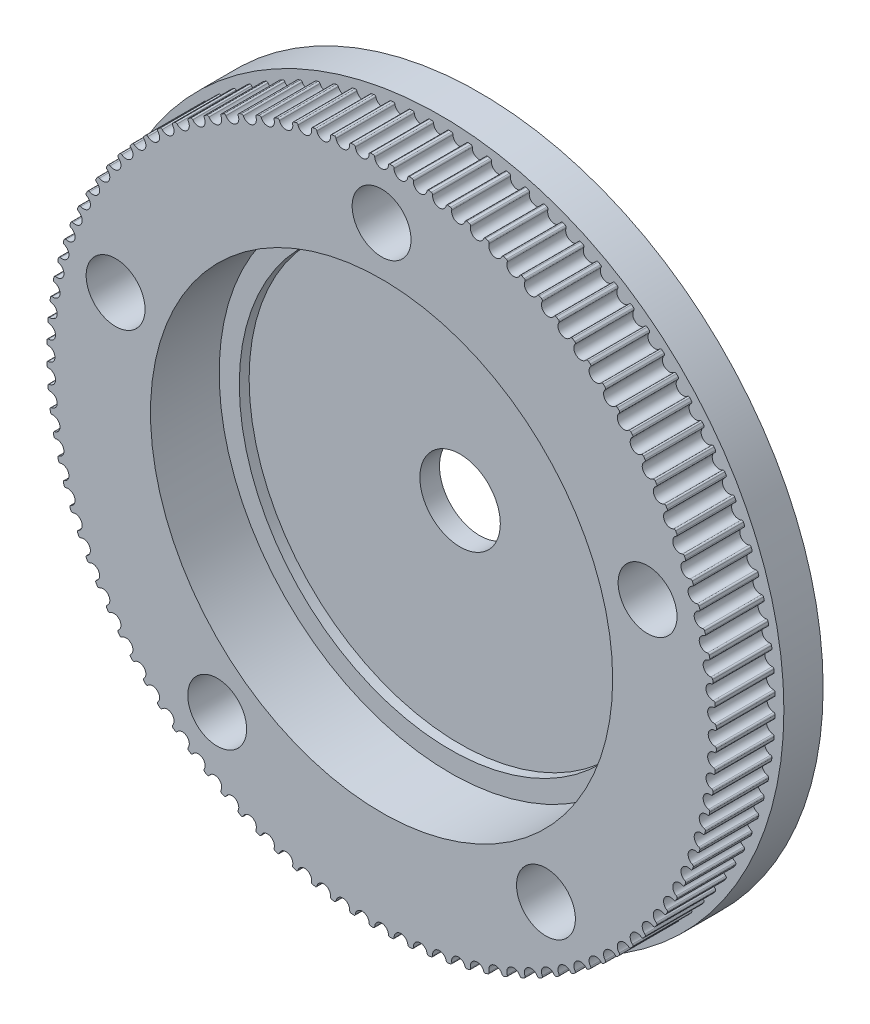
from build123d import *

# Parameters (mm, degrees)
SKETCH_1_R          = 35
SKETCH_1_R_2        = 4.1
EXTRUDE_1_DEPTH     = 4
SKETCH_2_R          = 4.1
EXTRUDE_2_DEPTH     = 6
SKETCH_4_R          = 23.55
CUT_EXTRUDE_2_DEPTH = 7
SKETCH_6_R          = 21.5
CUT_EXTRUDE_3_DEPTH = 1
SKETCH_7_R          = 1.75
CUT_EXTRUDE_4_DEPTH = 51.497524692
SKETCH_8_R          = 3
CUT_EXTRUDE_5_DEPTH = 8


with BuildPart() as part:
    # 草图1 → 凸台-拉伸1 (new body)
    with BuildSketch(Plane.XY):
        Circle(SKETCH_1_R)
        Circle(SKETCH_1_R_2, mode=Mode.SUBTRACT)
    extrude(amount=EXTRUDE_1_DEPTH)

    # 草图2 → 凸台-拉伸2 (add)
    with BuildSketch(Plane.XY.offset(4)):
        with BuildLine():
            ThreePointArc((1.121572838, 34.104062524), (0.992443315, 34.108064479), (0.863299566, 34.111577508))
            ThreePointArc((0.863299566, 34.111577508), (0.749968837, 34.068493113), (0.699390809, 33.95830245))
            ThreePointArc((0.699390809, 33.95830245), (0, 33.2875), (-0.699390809, 33.95830245))
            ThreePointArc((-0.699390809, 33.95830245), (-0.749968837, 34.068493113), (-0.863299566, 34.111577508))
            ThreePointArc((-0.863299566, 34.111577508), (-0.992443315, 34.108064479), (-1.121572838, 34.104062524))
            ThreePointArc((-1.121572838, 34.104062524), (-1.232206695, 34.054461424), (-1.276292136, 33.941516335))
            ThreePointArc((-1.276292136, 33.941516335), (-1.935495992, 33.231182818), (-2.672707236, 33.860184418))
            ThreePointArc((-2.672707236, 33.860184418), (-2.729606712, 33.967247805), (-2.845250838, 34.003669713))
            ThreePointArc((-2.845250838, 34.003669713), (-2.973971832, 33.992653586), (-3.102650195, 33.981150187))
            ThreePointArc((-3.102650195, 33.981150187), (-3.210212829, 33.925200218), (-3.247656512, 33.809882874))
            ThreePointArc((-3.247656512, 33.809882874), (-3.864442879, 33.062421833), (-4.636980068, 33.64749424))
            ThreePointArc((-4.636980068, 33.64749424), (-4.700008462, 33.751068082), (-4.817574682, 33.780704262))
            ThreePointArc((-4.817574682, 33.780704262), (-4.945437369, 33.762222312), (-5.073229166, 33.743256394))
            ThreePointArc((-5.073229166, 33.743256394), (-5.17735662, 33.681146873), (-5.208031846, 33.563847471))
            ThreePointArc((-5.208031846, 33.563847471), (-5.780313714, 32.781788078), (-6.585562828, 33.320951592))
            ThreePointArc((-6.585562828, 33.320951592), (-6.65450687, 33.420685429), (-6.773597378, 33.443435601))
            ThreePointArc((-6.773597378, 33.443435601), (-6.900169112, 33.417550366), (-7.026641935, 33.391186103))
            ThreePointArc((-7.026641935, 33.391186103), (-7.126981874, 33.323127188), (-7.15078485, 33.204242632))
            ThreePointArc((-7.15078485, 33.204242632), (-7.676625797, 32.390231129), (-8.511862127, 32.881661392))
            ThreePointArc((-8.511862127, 32.881661392), (-8.586488534, 32.977217756), (-8.706700364, 32.993004941))
            ThreePointArc((-8.706700364, 32.993004941), (-8.831552867, 32.959804008), (-8.956278772, 32.926130608))
            ThreePointArc((-8.956278772, 32.926130608), (-9.052491678, 32.85235259), (-9.06934186, 32.732285148))
            ThreePointArc((-9.06934186, 32.732285148), (-9.546962609, 31.889075891), (-10.40935998, 32.331110058))
            ThreePointArc((-10.40935998, 32.331110058), (-10.489416239, 32.422165616), (-10.610342633, 32.430936395))
            ThreePointArc((-10.610342633, 32.430936395), (-10.733053442, 32.390532105), (-10.855610397, 32.349663509))
            ThreePointArc((-10.855610397, 32.349663509), (-10.947370715, 32.270416029), (-10.957211089, 32.149571971))
            ThreePointArc((-10.957211089, 32.149571971), (-11.384995521, 31.280018114), (-12.271635853, 31.671160482))
            ThreePointArc((-12.271635853, 31.671160482), (-12.35685108, 31.75740713), (-12.47808286, 31.759131827))
            ThreePointArc((-12.47808286, 31.759131827), (-12.598236762, 31.711660895), (-12.718210072, 31.663735389))
            ThreePointArc((-12.718210072, 31.663735389), (-12.805207316, 31.579286595), (-12.808004584, 31.458074819))
            ThreePointArc((-12.808004584, 31.458074819), (-13.184505212, 30.565118658), (-14.092388395, 30.904045724))
            ThreePointArc((-14.092388395, 30.904045724), (-14.182474247, 30.985191632), (-14.303601206, 30.979864409))
            ThreePointArc((-14.303601206, 30.979864409), (-14.420791636, 30.925487463), (-14.53777535, 30.870667212))
            ThreePointArc((-14.53777535, 30.870667212), (-14.619715148, 30.781302852), (-14.615459846, 30.6601335))
            ThreePointArc((-14.615459846, 30.6601335), (-14.939402711, 29.746796515), (-15.865456755, 30.032361457))
            ThreePointArc((-15.865456755, 30.032361457), (-15.960108412, 30.108132053), (-16.080720692, 30.095770937))
            ThreePointArc((-16.080720692, 30.095770937), (-16.194551117, 30.034671971), (-16.308149399, 29.973142469))
            ThreePointArc((-16.308149399, 29.973142469), (-16.384754491, 29.879164923), (-16.373461017, 29.758447995))
            ThreePointArc((-16.373461017, 29.758447995), (-16.64375, 28.827820628), (-17.584841432, 29.059057186))
            ThreePointArc((-17.584841432, 29.059057186), (-17.683738622, 29.129196086), (-17.80342811, 29.109842902))
            ThreePointArc((-17.80342811, 29.109842902), (-17.913513362, 29.042228655), (-18.023341832, 28.974198099))
            ThreePointArc((-18.023341832, 28.974198099), (-18.094353013, 28.875925358), (-18.07605958, 28.756069321))
            ThreePointArc((-18.07605958, 28.756069321), (-18.291780108, 27.811300522), (-19.244724572, 27.987426264))
            ThreePointArc((-19.244724572, 27.987426264), (-19.347532657, 28.05169614), (-19.465894362, 28.025416374))
            ThreePointArc((-19.465894362, 28.025416374), (-19.571861949, 27.951515631), (-19.677548981, 27.877214214))
            ThreePointArc((-19.677548981, 27.877214214), (-19.742725971, 27.774978803), (-19.717494479, 27.656389212))
            ThreePointArc((-19.717494479, 27.656389212), (-19.877916621, 26.700675779), (-20.839489656, 26.821094751))
            ThreePointArc((-20.839489656, 26.821094751), (-20.945860767, 26.879278133), (-21.06249419, 26.846160708))
            ThreePointArc((-21.06249419, 26.846160708), (-21.163985551, 26.766223526), (-21.265173534, 26.685902661))
            ThreePointArc((-21.265173534, 26.685902661), (-21.324295793, 26.580050511), (-21.292211618, 26.463128635))
            ThreePointArc((-21.292211618, 26.463128635), (-21.396792557, 25.4997044), (-22.363740503, 25.564009143))
            ThreePointArc((-22.363740503, 25.564009143), (-22.473314714, 25.615909158), (-22.587825205, 25.576066132))
            ThreePointArc((-22.587825205, 25.576066132), (-22.684496924, 25.490362993), (-22.78084347, 25.40429446))
            ThreePointArc((-22.78084347, 25.40429446), (-22.833710949, 25.295183742), (-22.794882653, 25.180325208))
            ThreePointArc((-22.794882653, 25.180325208), (-22.843268521, 24.212450094), (-23.812319532, 24.22042302))
            ThreePointArc((-23.812319532, 24.22042302), (-23.924726078, 24.265864055), (-24.036726169, 24.219430244))
            ThreePointArc((-24.036726169, 24.219430244), (-24.128251141, 24.128251141), (-24.219430244, 24.036726169))
            ThreePointArc((-24.219430244, 24.036726169), (-24.265864055, 23.924726078), (-24.22042302, 23.812319532))
            ThreePointArc((-24.22042302, 23.812319532), (-24.212450094, 22.843268521), (-25.180325208, 22.794882653))
            ThreePointArc((-25.180325208, 22.794882653), (-25.295183742, 22.833710949), (-25.40429446, 22.78084347))
            ThreePointArc((-25.40429446, 22.78084347), (-25.490362993, 22.684496924), (-25.576066132, 22.587825205))
            ThreePointArc((-25.576066132, 22.587825205), (-25.615909158, 22.473314714), (-25.564009143, 22.363740503))
            ThreePointArc((-25.564009143, 22.363740503), (-25.4997044, 21.396792557), (-26.463128635, 21.292211618))
            ThreePointArc((-26.463128635, 21.292211618), (-26.580050511, 21.324295793), (-26.685902661, 21.265173534))
            ThreePointArc((-26.685902661, 21.265173534), (-26.766223526, 21.163985551), (-26.846160708, 21.06249419))
            ThreePointArc((-26.846160708, 21.06249419), (-26.879278133, 20.945860767), (-26.821094751, 20.839489656))
            ThreePointArc((-26.821094751, 20.839489656), (-26.700675779, 19.877916621), (-27.656389212, 19.717494479))
            ThreePointArc((-27.656389212, 19.717494479), (-27.774978803, 19.742725971), (-27.877214214, 19.677548981))
            ThreePointArc((-27.877214214, 19.677548981), (-27.951515631, 19.571861949), (-28.025416374, 19.465894362))
            ThreePointArc((-28.025416374, 19.465894362), (-28.05169614, 19.347532657), (-27.987426264, 19.244724572))
            ThreePointArc((-27.987426264, 19.244724572), (-27.811300522, 18.291780108), (-28.756069321, 18.07605958))
            ThreePointArc((-28.756069321, 18.07605958), (-28.875925358, 18.094353013), (-28.974198099, 18.023341832))
            ThreePointArc((-28.974198099, 18.023341832), (-29.042228655, 17.913513362), (-29.109842902, 17.80342811))
            ThreePointArc((-29.109842902, 17.80342811), (-29.129196086, 17.683738622), (-29.059057186, 17.584841432))
            ThreePointArc((-29.059057186, 17.584841432), (-28.827820628, 16.64375), (-29.758447995, 16.373461017))
            ThreePointArc((-29.758447995, 16.373461017), (-29.879164923, 16.384754491), (-29.973142469, 16.308149399))
            ThreePointArc((-29.973142469, 16.308149399), (-30.034671971, 16.194551117), (-30.095770937, 16.080720692))
            ThreePointArc((-30.095770937, 16.080720692), (-30.108132053, 15.960108412), (-30.032361457, 15.865456755))
            ThreePointArc((-30.032361457, 15.865456755), (-29.746796515, 14.939402711), (-30.6601335, 14.615459846))
            ThreePointArc((-30.6601335, 14.615459846), (-30.781302852, 14.619715148), (-30.870667212, 14.53777535))
            ThreePointArc((-30.870667212, 14.53777535), (-30.925487463, 14.420791636), (-30.979864409, 14.303601206))
            ThreePointArc((-30.979864409, 14.303601206), (-30.985191632, 14.182474247), (-30.904045724, 14.092388395))
            ThreePointArc((-30.904045724, 14.092388395), (-30.565118658, 13.184505212), (-31.458074819, 12.808004584))
            ThreePointArc((-31.458074819, 12.808004584), (-31.579286595, 12.805207316), (-31.663735389, 12.718210072))
            ThreePointArc((-31.663735389, 12.718210072), (-31.711660895, 12.598236762), (-31.759131827, 12.47808286))
            ThreePointArc((-31.759131827, 12.47808286), (-31.75740713, 12.35685108), (-31.671160482, 12.271635853))
            ThreePointArc((-31.671160482, 12.271635853), (-31.280018114, 11.384995521), (-32.149571971, 10.957211089))
            ThreePointArc((-32.149571971, 10.957211089), (-32.270416029, 10.947370715), (-32.349663509, 10.855610397))
            ThreePointArc((-32.349663509, 10.855610397), (-32.390532105, 10.733053442), (-32.430936395, 10.610342633))
            ThreePointArc((-32.430936395, 10.610342633), (-32.422165616, 10.489416239), (-32.331110058, 10.40935998))
            ThreePointArc((-32.331110058, 10.40935998), (-31.889075891, 9.546962609), (-32.732285148, 9.06934186))
            ThreePointArc((-32.732285148, 9.06934186), (-32.85235259, 9.052491678), (-32.926130608, 8.956278772))
            ThreePointArc((-32.926130608, 8.956278772), (-32.959804008, 8.831552867), (-32.993004941, 8.706700364))
            ThreePointArc((-32.993004941, 8.706700364), (-32.977217756, 8.586488534), (-32.881661392, 8.511862127))
            ThreePointArc((-32.881661392, 8.511862127), (-32.390231129, 7.676625797), (-33.204242632, 7.15078485))
            ThreePointArc((-33.204242632, 7.15078485), (-33.323127188, 7.126981874), (-33.391186103, 7.026641935))
            ThreePointArc((-33.391186103, 7.026641935), (-33.417550366, 6.900169112), (-33.443435601, 6.773597378))
            ThreePointArc((-33.443435601, 6.773597378), (-33.420685429, 6.65450687), (-33.320951592, 6.585562828))
            ThreePointArc((-33.320951592, 6.585562828), (-32.781788078, 5.780313714), (-33.563847471, 5.208031846))
            ThreePointArc((-33.563847471, 5.208031846), (-33.681146873, 5.17735662), (-33.743256394, 5.073229166))
            ThreePointArc((-33.743256394, 5.073229166), (-33.762222312, 4.945437369), (-33.780704262, 4.817574682))
            ThreePointArc((-33.780704262, 4.817574682), (-33.751068082, 4.700008462), (-33.64749424, 4.636980068))
            ThreePointArc((-33.64749424, 4.636980068), (-33.062421833, 3.864442879), (-33.809882874, 3.247656512))
            ThreePointArc((-33.809882874, 3.247656512), (-33.925200218, 3.210212829), (-33.981150187, 3.102650195))
            ThreePointArc((-33.981150187, 3.102650195), (-33.992653586, 2.973971832), (-34.003669713, 2.845250838))
            ThreePointArc((-34.003669713, 2.845250838), (-33.967247805, 2.729606712), (-33.860184418, 2.672707236))
            ThreePointArc((-33.860184418, 2.672707236), (-33.231182818, 1.935495992), (-33.941516335, 1.276292136))
            ThreePointArc((-33.941516335, 1.276292136), (-34.054461424, 1.232206695), (-34.104062524, 1.121572838))
            ThreePointArc((-34.104062524, 1.121572838), (-34.108064479, 0.992443315), (-34.111577508, 0.863299566))
            ThreePointArc((-34.111577508, 0.863299566), (-34.068493113, 0.749968837), (-33.95830245, 0.699390809))
            ThreePointArc((-33.95830245, 0.699390809), (-33.2875, 0), (-33.95830245, -0.699390809))
            ThreePointArc((-33.95830245, -0.699390809), (-34.068493113, -0.749968837), (-34.111577508, -0.863299566))
            ThreePointArc((-34.111577508, -0.863299566), (-34.108064479, -0.992443315), (-34.104062524, -1.121572838))
            ThreePointArc((-34.104062524, -1.121572838), (-34.054461424, -1.232206695), (-33.941516335, -1.276292136))
            ThreePointArc((-33.941516335, -1.276292136), (-33.231182818, -1.935495992), (-33.860184418, -2.672707236))
            ThreePointArc((-33.860184418, -2.672707236), (-33.967247805, -2.729606712), (-34.003669713, -2.845250838))
            ThreePointArc((-34.003669713, -2.845250838), (-33.992653586, -2.973971832), (-33.981150187, -3.102650195))
            ThreePointArc((-33.981150187, -3.102650195), (-33.925200218, -3.210212829), (-33.809882874, -3.247656512))
            ThreePointArc((-33.809882874, -3.247656512), (-33.062421833, -3.864442879), (-33.64749424, -4.636980068))
            ThreePointArc((-33.64749424, -4.636980068), (-33.751068082, -4.700008462), (-33.780704262, -4.817574682))
            ThreePointArc((-33.780704262, -4.817574682), (-33.762222312, -4.945437369), (-33.743256394, -5.073229166))
            ThreePointArc((-33.743256394, -5.073229166), (-33.681146873, -5.17735662), (-33.563847471, -5.208031846))
            ThreePointArc((-33.563847471, -5.208031846), (-32.781788078, -5.780313714), (-33.320951592, -6.585562828))
            ThreePointArc((-33.320951592, -6.585562828), (-33.420685429, -6.65450687), (-33.443435601, -6.773597378))
            ThreePointArc((-33.443435601, -6.773597378), (-33.417550366, -6.900169112), (-33.391186103, -7.026641935))
            ThreePointArc((-33.391186103, -7.026641935), (-33.323127188, -7.126981874), (-33.204242632, -7.15078485))
            ThreePointArc((-33.204242632, -7.15078485), (-32.390231129, -7.676625797), (-32.881661392, -8.511862127))
            ThreePointArc((-32.881661392, -8.511862127), (-32.977217756, -8.586488534), (-32.993004941, -8.706700364))
            ThreePointArc((-32.993004941, -8.706700364), (-32.959804008, -8.831552867), (-32.926130608, -8.956278772))
            ThreePointArc((-32.926130608, -8.956278772), (-32.85235259, -9.052491678), (-32.732285148, -9.06934186))
            ThreePointArc((-32.732285148, -9.06934186), (-31.889075891, -9.546962609), (-32.331110058, -10.40935998))
            ThreePointArc((-32.331110058, -10.40935998), (-32.422165616, -10.489416239), (-32.430936395, -10.610342633))
            ThreePointArc((-32.430936395, -10.610342633), (-32.390532105, -10.733053442), (-32.349663509, -10.855610397))
            ThreePointArc((-32.349663509, -10.855610397), (-32.270416029, -10.947370715), (-32.149571971, -10.957211089))
            ThreePointArc((-32.149571971, -10.957211089), (-31.280018114, -11.384995521), (-31.671160482, -12.271635853))
            ThreePointArc((-31.671160482, -12.271635853), (-31.75740713, -12.35685108), (-31.759131827, -12.47808286))
            ThreePointArc((-31.759131827, -12.47808286), (-31.711660895, -12.598236762), (-31.663735389, -12.718210072))
            ThreePointArc((-31.663735389, -12.718210072), (-31.579286595, -12.805207316), (-31.458074819, -12.808004584))
            ThreePointArc((-31.458074819, -12.808004584), (-30.565118658, -13.184505212), (-30.904045724, -14.092388395))
            ThreePointArc((-30.904045724, -14.092388395), (-30.985191632, -14.182474247), (-30.979864409, -14.303601206))
            ThreePointArc((-30.979864409, -14.303601206), (-30.925487463, -14.420791636), (-30.870667212, -14.53777535))
            ThreePointArc((-30.870667212, -14.53777535), (-30.781302852, -14.619715148), (-30.6601335, -14.615459846))
            ThreePointArc((-30.6601335, -14.615459846), (-29.746796515, -14.939402711), (-30.032361457, -15.865456755))
            ThreePointArc((-30.032361457, -15.865456755), (-30.108132053, -15.960108412), (-30.095770937, -16.080720692))
            ThreePointArc((-30.095770937, -16.080720692), (-30.034671971, -16.194551117), (-29.973142469, -16.308149399))
            ThreePointArc((-29.973142469, -16.308149399), (-29.879164923, -16.384754491), (-29.758447995, -16.373461017))
            ThreePointArc((-29.758447995, -16.373461017), (-28.827820628, -16.64375), (-29.059057186, -17.584841432))
            ThreePointArc((-29.059057186, -17.584841432), (-29.129196086, -17.683738622), (-29.109842902, -17.80342811))
            ThreePointArc((-29.109842902, -17.80342811), (-29.042228655, -17.913513362), (-28.974198099, -18.023341832))
            ThreePointArc((-28.974198099, -18.023341832), (-28.875925358, -18.094353013), (-28.756069321, -18.07605958))
            ThreePointArc((-28.756069321, -18.07605958), (-27.811300522, -18.291780108), (-27.987426264, -19.244724572))
            ThreePointArc((-27.987426264, -19.244724572), (-28.05169614, -19.347532657), (-28.025416374, -19.465894362))
            ThreePointArc((-28.025416374, -19.465894362), (-27.951515631, -19.571861949), (-27.877214214, -19.677548981))
            ThreePointArc((-27.877214214, -19.677548981), (-27.774978803, -19.742725971), (-27.656389212, -19.717494479))
            ThreePointArc((-27.656389212, -19.717494479), (-26.700675779, -19.877916621), (-26.821094751, -20.839489656))
            ThreePointArc((-26.821094751, -20.839489656), (-26.879278133, -20.945860767), (-26.846160708, -21.06249419))
            ThreePointArc((-26.846160708, -21.06249419), (-26.766223526, -21.163985551), (-26.685902661, -21.265173534))
            ThreePointArc((-26.685902661, -21.265173534), (-26.580050511, -21.324295793), (-26.463128635, -21.292211618))
            ThreePointArc((-26.463128635, -21.292211618), (-25.4997044, -21.396792557), (-25.564009143, -22.363740503))
            ThreePointArc((-25.564009143, -22.363740503), (-25.615909158, -22.473314714), (-25.576066132, -22.587825205))
            ThreePointArc((-25.576066132, -22.587825205), (-25.490362993, -22.684496924), (-25.40429446, -22.78084347))
            ThreePointArc((-25.40429446, -22.78084347), (-25.295183742, -22.833710949), (-25.180325208, -22.794882653))
            ThreePointArc((-25.180325208, -22.794882653), (-24.212450094, -22.843268521), (-24.22042302, -23.812319532))
            ThreePointArc((-24.22042302, -23.812319532), (-24.265864055, -23.924726078), (-24.219430244, -24.036726169))
            ThreePointArc((-24.219430244, -24.036726169), (-24.128251141, -24.128251141), (-24.036726169, -24.219430244))
            ThreePointArc((-24.036726169, -24.219430244), (-23.924726078, -24.265864055), (-23.812319532, -24.22042302))
            ThreePointArc((-23.812319532, -24.22042302), (-22.843268521, -24.212450094), (-22.794882653, -25.180325208))
            ThreePointArc((-22.794882653, -25.180325208), (-22.833710949, -25.295183742), (-22.78084347, -25.40429446))
            ThreePointArc((-22.78084347, -25.40429446), (-22.684496924, -25.490362993), (-22.587825205, -25.576066132))
            ThreePointArc((-22.587825205, -25.576066132), (-22.473314714, -25.615909158), (-22.363740503, -25.564009143))
            ThreePointArc((-22.363740503, -25.564009143), (-21.396792557, -25.4997044), (-21.292211618, -26.463128635))
            ThreePointArc((-21.292211618, -26.463128635), (-21.324295793, -26.580050511), (-21.265173534, -26.685902661))
            ThreePointArc((-21.265173534, -26.685902661), (-21.163985551, -26.766223526), (-21.06249419, -26.846160708))
            ThreePointArc((-21.06249419, -26.846160708), (-20.945860767, -26.879278133), (-20.839489656, -26.821094751))
            ThreePointArc((-20.839489656, -26.821094751), (-19.877916621, -26.700675779), (-19.717494479, -27.656389212))
            ThreePointArc((-19.717494479, -27.656389212), (-19.742725971, -27.774978803), (-19.677548981, -27.877214214))
            ThreePointArc((-19.677548981, -27.877214214), (-19.571861949, -27.951515631), (-19.465894362, -28.025416374))
            ThreePointArc((-19.465894362, -28.025416374), (-19.347532657, -28.05169614), (-19.244724572, -27.987426264))
            ThreePointArc((-19.244724572, -27.987426264), (-18.291780108, -27.811300522), (-18.07605958, -28.756069321))
            ThreePointArc((-18.07605958, -28.756069321), (-18.094353013, -28.875925358), (-18.023341832, -28.974198099))
            ThreePointArc((-18.023341832, -28.974198099), (-17.913513362, -29.042228655), (-17.80342811, -29.109842902))
            ThreePointArc((-17.80342811, -29.109842902), (-17.683738622, -29.129196086), (-17.584841432, -29.059057186))
            ThreePointArc((-17.584841432, -29.059057186), (-16.64375, -28.827820628), (-16.373461017, -29.758447995))
            ThreePointArc((-16.373461017, -29.758447995), (-16.384754491, -29.879164923), (-16.308149399, -29.973142469))
            ThreePointArc((-16.308149399, -29.973142469), (-16.194551117, -30.034671971), (-16.080720692, -30.095770937))
            ThreePointArc((-16.080720692, -30.095770937), (-15.960108412, -30.108132053), (-15.865456755, -30.032361457))
            ThreePointArc((-15.865456755, -30.032361457), (-14.939402711, -29.746796515), (-14.615459846, -30.6601335))
            ThreePointArc((-14.615459846, -30.6601335), (-14.619715148, -30.781302852), (-14.53777535, -30.870667212))
            ThreePointArc((-14.53777535, -30.870667212), (-14.420791636, -30.925487463), (-14.303601205, -30.979864409))
            ThreePointArc((-14.303601205, -30.979864409), (-14.182474247, -30.985191632), (-14.092388395, -30.904045724))
            ThreePointArc((-14.092388395, -30.904045724), (-13.184505212, -30.565118658), (-12.808004584, -31.458074819))
            ThreePointArc((-12.808004584, -31.458074819), (-12.805207316, -31.579286595), (-12.718210072, -31.663735389))
            ThreePointArc((-12.718210072, -31.663735389), (-12.598236762, -31.711660895), (-12.47808286, -31.759131827))
            ThreePointArc((-12.47808286, -31.759131827), (-12.35685108, -31.75740713), (-12.271635853, -31.671160482))
            ThreePointArc((-12.271635853, -31.671160482), (-11.384995521, -31.280018114), (-10.957211089, -32.149571971))
            ThreePointArc((-10.957211089, -32.149571971), (-10.947370715, -32.270416029), (-10.855610397, -32.349663509))
            ThreePointArc((-10.855610397, -32.349663509), (-10.733053442, -32.390532105), (-10.610342633, -32.430936395))
            ThreePointArc((-10.610342633, -32.430936395), (-10.489416239, -32.422165616), (-10.40935998, -32.331110058))
            ThreePointArc((-10.40935998, -32.331110058), (-9.546962609, -31.889075891), (-9.06934186, -32.732285148))
            ThreePointArc((-9.06934186, -32.732285148), (-9.052491678, -32.85235259), (-8.956278772, -32.926130608))
            ThreePointArc((-8.956278772, -32.926130608), (-8.831552867, -32.959804008), (-8.706700364, -32.993004941))
            ThreePointArc((-8.706700364, -32.993004941), (-8.586488534, -32.977217756), (-8.511862127, -32.881661392))
            ThreePointArc((-8.511862127, -32.881661392), (-7.676625797, -32.390231129), (-7.15078485, -33.204242632))
            ThreePointArc((-7.15078485, -33.204242632), (-7.126981874, -33.323127188), (-7.026641935, -33.391186103))
            ThreePointArc((-7.026641935, -33.391186103), (-6.900169112, -33.417550366), (-6.773597378, -33.443435601))
            ThreePointArc((-6.773597378, -33.443435601), (-6.65450687, -33.420685429), (-6.585562828, -33.320951592))
            ThreePointArc((-6.585562828, -33.320951592), (-5.780313714, -32.781788078), (-5.208031846, -33.563847471))
            ThreePointArc((-5.208031846, -33.563847471), (-5.17735662, -33.681146873), (-5.073229166, -33.743256394))
            ThreePointArc((-5.073229166, -33.743256394), (-4.945437369, -33.762222312), (-4.817574682, -33.780704262))
            ThreePointArc((-4.817574682, -33.780704262), (-4.700008462, -33.751068082), (-4.636980068, -33.64749424))
            ThreePointArc((-4.636980068, -33.64749424), (-3.864442879, -33.062421833), (-3.247656512, -33.809882874))
            ThreePointArc((-3.247656512, -33.809882874), (-3.210212829, -33.925200218), (-3.102650195, -33.981150187))
            ThreePointArc((-3.102650195, -33.981150187), (-2.973971832, -33.992653586), (-2.845250838, -34.003669713))
            ThreePointArc((-2.845250838, -34.003669713), (-2.729606712, -33.967247805), (-2.672707236, -33.860184418))
            ThreePointArc((-2.672707236, -33.860184418), (-1.935495992, -33.231182818), (-1.276292136, -33.941516335))
            ThreePointArc((-1.276292136, -33.941516335), (-1.232206695, -34.054461424), (-1.121572838, -34.104062524))
            ThreePointArc((-1.121572838, -34.104062524), (-0.992443315, -34.108064479), (-0.863299566, -34.111577508))
            ThreePointArc((-0.863299566, -34.111577508), (-0.749968837, -34.068493113), (-0.699390809, -33.95830245))
            ThreePointArc((-0.699390809, -33.95830245), (0, -33.2875), (0.699390809, -33.95830245))
            ThreePointArc((0.699390809, -33.95830245), (0.749968837, -34.068493113), (0.863299566, -34.111577508))
            ThreePointArc((0.863299566, -34.111577508), (0.992443315, -34.108064479), (1.121572838, -34.104062524))
            ThreePointArc((1.121572838, -34.104062524), (1.232206695, -34.054461424), (1.276292136, -33.941516335))
            ThreePointArc((1.276292136, -33.941516335), (1.935495992, -33.231182818), (2.672707236, -33.860184418))
            ThreePointArc((2.672707236, -33.860184418), (2.729606712, -33.967247805), (2.845250838, -34.003669713))
            ThreePointArc((2.845250838, -34.003669713), (2.973971832, -33.992653586), (3.102650195, -33.981150187))
            ThreePointArc((3.102650195, -33.981150187), (3.210212829, -33.925200218), (3.247656512, -33.809882874))
            ThreePointArc((3.247656512, -33.809882874), (3.864442879, -33.062421833), (4.636980068, -33.64749424))
            ThreePointArc((4.636980068, -33.64749424), (4.700008462, -33.751068082), (4.817574682, -33.780704262))
            ThreePointArc((4.817574682, -33.780704262), (4.945437369, -33.762222312), (5.073229166, -33.743256394))
            ThreePointArc((5.073229166, -33.743256394), (5.17735662, -33.681146873), (5.208031846, -33.563847471))
            ThreePointArc((5.208031846, -33.563847471), (5.780313714, -32.781788078), (6.585562828, -33.320951592))
            ThreePointArc((6.585562828, -33.320951592), (6.65450687, -33.420685429), (6.773597378, -33.443435601))
            ThreePointArc((6.773597378, -33.443435601), (6.900169112, -33.417550366), (7.026641935, -33.391186103))
            ThreePointArc((7.026641935, -33.391186103), (7.126981874, -33.323127188), (7.15078485, -33.204242632))
            ThreePointArc((7.15078485, -33.204242632), (7.676625797, -32.390231129), (8.511862127, -32.881661392))
            ThreePointArc((8.511862127, -32.881661392), (8.586488534, -32.977217756), (8.706700364, -32.993004941))
            ThreePointArc((8.706700364, -32.993004941), (8.831552867, -32.959804008), (8.956278772, -32.926130608))
            ThreePointArc((8.956278772, -32.926130608), (9.052491678, -32.85235259), (9.06934186, -32.732285148))
            ThreePointArc((9.06934186, -32.732285148), (9.546962609, -31.889075891), (10.40935998, -32.331110058))
            ThreePointArc((10.40935998, -32.331110058), (10.489416239, -32.422165616), (10.610342633, -32.430936395))
            ThreePointArc((10.610342633, -32.430936395), (10.733053442, -32.390532105), (10.855610397, -32.349663509))
            ThreePointArc((10.855610397, -32.349663509), (10.947370715, -32.270416029), (10.957211089, -32.149571971))
            ThreePointArc((10.957211089, -32.149571971), (11.384995521, -31.280018114), (12.271635853, -31.671160482))
            ThreePointArc((12.271635853, -31.671160482), (12.35685108, -31.75740713), (12.47808286, -31.759131827))
            ThreePointArc((12.47808286, -31.759131827), (12.598236762, -31.711660895), (12.718210072, -31.663735389))
            ThreePointArc((12.718210072, -31.663735389), (12.805207316, -31.579286595), (12.808004584, -31.458074819))
            ThreePointArc((12.808004584, -31.458074819), (13.184505212, -30.565118658), (14.092388395, -30.904045724))
            ThreePointArc((14.092388395, -30.904045724), (14.182474247, -30.985191632), (14.303601205, -30.979864409))
            ThreePointArc((14.303601205, -30.979864409), (14.420791636, -30.925487463), (14.53777535, -30.870667212))
            ThreePointArc((14.53777535, -30.870667212), (14.619715148, -30.781302852), (14.615459846, -30.6601335))
            ThreePointArc((14.615459846, -30.6601335), (14.939402711, -29.746796515), (15.865456755, -30.032361457))
            ThreePointArc((15.865456755, -30.032361457), (15.960108412, -30.108132053), (16.080720692, -30.095770937))
            ThreePointArc((16.080720692, -30.095770937), (16.194551117, -30.034671971), (16.308149399, -29.973142469))
            ThreePointArc((16.308149399, -29.973142469), (16.384754491, -29.879164923), (16.373461017, -29.758447995))
            ThreePointArc((16.373461017, -29.758447995), (16.64375, -28.827820628), (17.584841432, -29.059057186))
            ThreePointArc((17.584841432, -29.059057186), (17.683738622, -29.129196086), (17.80342811, -29.109842902))
            ThreePointArc((17.80342811, -29.109842902), (17.913513362, -29.042228655), (18.023341832, -28.974198099))
            ThreePointArc((18.023341832, -28.974198099), (18.094353013, -28.875925358), (18.07605958, -28.756069321))
            ThreePointArc((18.07605958, -28.756069321), (18.291780108, -27.811300522), (19.244724572, -27.987426264))
            ThreePointArc((19.244724572, -27.987426264), (19.347532657, -28.05169614), (19.465894362, -28.025416374))
            ThreePointArc((19.465894362, -28.025416374), (19.571861949, -27.951515631), (19.677548981, -27.877214214))
            ThreePointArc((19.677548981, -27.877214214), (19.742725971, -27.774978803), (19.717494479, -27.656389212))
            ThreePointArc((19.717494479, -27.656389212), (19.877916621, -26.700675779), (20.839489656, -26.821094751))
            ThreePointArc((20.839489656, -26.821094751), (20.945860767, -26.879278133), (21.06249419, -26.846160708))
            ThreePointArc((21.06249419, -26.846160708), (21.163985551, -26.766223526), (21.265173534, -26.685902661))
            ThreePointArc((21.265173534, -26.685902661), (21.324295793, -26.580050511), (21.292211618, -26.463128635))
            ThreePointArc((21.292211618, -26.463128635), (21.396792557, -25.4997044), (22.363740503, -25.564009143))
            ThreePointArc((22.363740503, -25.564009143), (22.473314714, -25.615909158), (22.587825205, -25.576066132))
            ThreePointArc((22.587825205, -25.576066132), (22.684496924, -25.490362993), (22.78084347, -25.40429446))
            ThreePointArc((22.78084347, -25.40429446), (22.833710949, -25.295183742), (22.794882653, -25.180325208))
            ThreePointArc((22.794882653, -25.180325208), (22.843268521, -24.212450094), (23.812319532, -24.22042302))
            ThreePointArc((23.812319532, -24.22042302), (23.924726078, -24.265864055), (24.036726169, -24.219430244))
            ThreePointArc((24.036726169, -24.219430244), (24.128251141, -24.128251141), (24.219430244, -24.036726169))
            ThreePointArc((24.219430244, -24.036726169), (24.265864055, -23.924726078), (24.22042302, -23.812319532))
            ThreePointArc((24.22042302, -23.812319532), (24.212450094, -22.843268521), (25.180325208, -22.794882653))
            ThreePointArc((25.180325208, -22.794882653), (25.295183742, -22.833710949), (25.40429446, -22.78084347))
            ThreePointArc((25.40429446, -22.78084347), (25.490362993, -22.684496924), (25.576066132, -22.587825205))
            ThreePointArc((25.576066132, -22.587825205), (25.615909158, -22.473314714), (25.564009143, -22.363740503))
            ThreePointArc((25.564009143, -22.363740503), (25.4997044, -21.396792557), (26.463128635, -21.292211618))
            ThreePointArc((26.463128635, -21.292211618), (26.580050511, -21.324295793), (26.685902661, -21.265173534))
            ThreePointArc((26.685902661, -21.265173534), (26.766223526, -21.163985551), (26.846160708, -21.06249419))
            ThreePointArc((26.846160708, -21.06249419), (26.879278133, -20.945860767), (26.821094751, -20.839489656))
            ThreePointArc((26.821094751, -20.839489656), (26.700675779, -19.877916621), (27.656389212, -19.717494479))
            ThreePointArc((27.656389212, -19.717494479), (27.774978803, -19.742725971), (27.877214214, -19.677548981))
            ThreePointArc((27.877214214, -19.677548981), (27.951515631, -19.571861949), (28.025416374, -19.465894362))
            ThreePointArc((28.025416374, -19.465894362), (28.05169614, -19.347532657), (27.987426264, -19.244724572))
            ThreePointArc((27.987426264, -19.244724572), (27.811300522, -18.291780108), (28.756069321, -18.07605958))
            ThreePointArc((28.756069321, -18.07605958), (28.875925358, -18.094353013), (28.974198099, -18.023341832))
            ThreePointArc((28.974198099, -18.023341832), (29.042228655, -17.913513362), (29.109842902, -17.80342811))
            ThreePointArc((29.109842902, -17.80342811), (29.129196086, -17.683738622), (29.059057186, -17.584841432))
            ThreePointArc((29.059057186, -17.584841432), (28.827820628, -16.64375), (29.758447995, -16.373461017))
            ThreePointArc((29.758447995, -16.373461017), (29.879164923, -16.384754491), (29.973142469, -16.308149399))
            ThreePointArc((29.973142469, -16.308149399), (30.034671971, -16.194551117), (30.095770937, -16.080720692))
            ThreePointArc((30.095770937, -16.080720692), (30.108132053, -15.960108412), (30.032361457, -15.865456755))
            ThreePointArc((30.032361457, -15.865456755), (29.746796515, -14.939402711), (30.6601335, -14.615459846))
            ThreePointArc((30.6601335, -14.615459846), (30.781302852, -14.619715148), (30.870667212, -14.53777535))
            ThreePointArc((30.870667212, -14.53777535), (30.925487463, -14.420791636), (30.979864409, -14.303601206))
            ThreePointArc((30.979864409, -14.303601206), (30.985191632, -14.182474247), (30.904045724, -14.092388395))
            ThreePointArc((30.904045724, -14.092388395), (30.565118658, -13.184505212), (31.458074819, -12.808004584))
            ThreePointArc((31.458074819, -12.808004584), (31.579286595, -12.805207316), (31.663735389, -12.718210072))
            ThreePointArc((31.663735389, -12.718210072), (31.711660895, -12.598236762), (31.759131827, -12.47808286))
            ThreePointArc((31.759131827, -12.47808286), (31.75740713, -12.35685108), (31.671160482, -12.271635853))
            ThreePointArc((31.671160482, -12.271635853), (31.280018114, -11.384995521), (32.149571971, -10.957211089))
            ThreePointArc((32.149571971, -10.957211089), (32.270416029, -10.947370715), (32.349663509, -10.855610397))
            ThreePointArc((32.349663509, -10.855610397), (32.390532105, -10.733053442), (32.430936395, -10.610342633))
            ThreePointArc((32.430936395, -10.610342633), (32.422165616, -10.489416239), (32.331110058, -10.40935998))
            ThreePointArc((32.331110058, -10.40935998), (31.889075891, -9.546962609), (32.732285148, -9.06934186))
            ThreePointArc((32.732285148, -9.06934186), (32.85235259, -9.052491678), (32.926130608, -8.956278772))
            ThreePointArc((32.926130608, -8.956278772), (32.959804008, -8.831552867), (32.993004941, -8.706700364))
            ThreePointArc((32.993004941, -8.706700364), (32.977217756, -8.586488534), (32.881661392, -8.511862127))
            ThreePointArc((32.881661392, -8.511862127), (32.390231129, -7.676625797), (33.204242632, -7.15078485))
            ThreePointArc((33.204242632, -7.15078485), (33.323127188, -7.126981874), (33.391186103, -7.026641935))
            ThreePointArc((33.391186103, -7.026641935), (33.417550366, -6.900169112), (33.443435601, -6.773597378))
            ThreePointArc((33.443435601, -6.773597378), (33.420685429, -6.65450687), (33.320951592, -6.585562828))
            ThreePointArc((33.320951592, -6.585562828), (32.781788078, -5.780313714), (33.563847471, -5.208031846))
            ThreePointArc((33.563847471, -5.208031846), (33.681146873, -5.17735662), (33.743256394, -5.073229166))
            ThreePointArc((33.743256394, -5.073229166), (33.762222312, -4.945437369), (33.780704262, -4.817574682))
            ThreePointArc((33.780704262, -4.817574682), (33.751068082, -4.700008462), (33.64749424, -4.636980068))
            ThreePointArc((33.64749424, -4.636980068), (33.062421833, -3.864442879), (33.809882874, -3.247656512))
            ThreePointArc((33.809882874, -3.247656512), (33.925200218, -3.210212829), (33.981150187, -3.102650195))
            ThreePointArc((33.981150187, -3.102650195), (33.992653586, -2.973971832), (34.003669713, -2.845250838))
            ThreePointArc((34.003669713, -2.845250838), (33.967247805, -2.729606712), (33.860184418, -2.672707236))
            ThreePointArc((33.860184418, -2.672707236), (33.231182818, -1.935495992), (33.941516335, -1.276292136))
            ThreePointArc((33.941516335, -1.276292136), (34.054461424, -1.232206695), (34.104062524, -1.121572838))
            ThreePointArc((34.104062524, -1.121572838), (34.108064479, -0.992443315), (34.111577508, -0.863299566))
            ThreePointArc((34.111577508, -0.863299566), (34.068493113, -0.749968837), (33.95830245, -0.699390809))
            ThreePointArc((33.95830245, -0.699390809), (33.2875, 0), (33.95830245, 0.699390809))
            ThreePointArc((33.95830245, 0.699390809), (34.068493113, 0.749968837), (34.111577508, 0.863299566))
            ThreePointArc((34.111577508, 0.863299566), (34.108064479, 0.992443315), (34.104062524, 1.121572838))
            ThreePointArc((34.104062524, 1.121572838), (34.054461424, 1.232206695), (33.941516335, 1.276292136))
            ThreePointArc((33.941516335, 1.276292136), (33.231182818, 1.935495992), (33.860184418, 2.672707236))
            ThreePointArc((33.860184418, 2.672707236), (33.967247805, 2.729606712), (34.003669713, 2.845250838))
            ThreePointArc((34.003669713, 2.845250838), (33.992653586, 2.973971832), (33.981150187, 3.102650195))
            ThreePointArc((33.981150187, 3.102650195), (33.925200218, 3.210212829), (33.809882874, 3.247656512))
            ThreePointArc((33.809882874, 3.247656512), (33.062421833, 3.864442879), (33.64749424, 4.636980068))
            ThreePointArc((33.64749424, 4.636980068), (33.751068082, 4.700008462), (33.780704262, 4.817574682))
            ThreePointArc((33.780704262, 4.817574682), (33.762222312, 4.945437369), (33.743256394, 5.073229166))
            ThreePointArc((33.743256394, 5.073229166), (33.681146873, 5.17735662), (33.563847471, 5.208031846))
            ThreePointArc((33.563847471, 5.208031846), (32.781788078, 5.780313714), (33.320951592, 6.585562828))
            ThreePointArc((33.320951592, 6.585562828), (33.420685429, 6.65450687), (33.443435601, 6.773597378))
            ThreePointArc((33.443435601, 6.773597378), (33.417550366, 6.900169112), (33.391186103, 7.026641935))
            ThreePointArc((33.391186103, 7.026641935), (33.323127188, 7.126981874), (33.204242632, 7.15078485))
            ThreePointArc((33.204242632, 7.15078485), (32.390231129, 7.676625797), (32.881661392, 8.511862127))
            ThreePointArc((32.881661392, 8.511862127), (32.977217756, 8.586488534), (32.993004941, 8.706700364))
            ThreePointArc((32.993004941, 8.706700364), (32.959804008, 8.831552867), (32.926130608, 8.956278772))
            ThreePointArc((32.926130608, 8.956278772), (32.85235259, 9.052491678), (32.732285148, 9.06934186))
            ThreePointArc((32.732285148, 9.06934186), (31.889075891, 9.546962609), (32.331110058, 10.40935998))
            ThreePointArc((32.331110058, 10.40935998), (32.422165616, 10.489416239), (32.430936395, 10.610342633))
            ThreePointArc((32.430936395, 10.610342633), (32.390532105, 10.733053442), (32.349663509, 10.855610397))
            ThreePointArc((32.349663509, 10.855610397), (32.270416029, 10.947370715), (32.149571971, 10.957211089))
            ThreePointArc((32.149571971, 10.957211089), (31.280018114, 11.384995521), (31.671160482, 12.271635853))
            ThreePointArc((31.671160482, 12.271635853), (31.75740713, 12.35685108), (31.759131827, 12.47808286))
            ThreePointArc((31.759131827, 12.47808286), (31.711660895, 12.598236762), (31.663735389, 12.718210072))
            ThreePointArc((31.663735389, 12.718210072), (31.579286595, 12.805207316), (31.458074819, 12.808004584))
            ThreePointArc((31.458074819, 12.808004584), (30.565118658, 13.184505212), (30.904045724, 14.092388395))
            ThreePointArc((30.904045724, 14.092388395), (30.985191632, 14.182474247), (30.979864409, 14.303601206))
            ThreePointArc((30.979864409, 14.303601206), (30.925487463, 14.420791636), (30.870667212, 14.53777535))
            ThreePointArc((30.870667212, 14.53777535), (30.781302852, 14.619715148), (30.6601335, 14.615459846))
            ThreePointArc((30.6601335, 14.615459846), (29.746796515, 14.939402711), (30.032361457, 15.865456755))
            ThreePointArc((30.032361457, 15.865456755), (30.108132053, 15.960108412), (30.095770937, 16.080720692))
            ThreePointArc((30.095770937, 16.080720692), (30.034671971, 16.194551117), (29.973142469, 16.308149399))
            ThreePointArc((29.973142469, 16.308149399), (29.879164923, 16.384754491), (29.758447995, 16.373461017))
            ThreePointArc((29.758447995, 16.373461017), (28.827820628, 16.64375), (29.059057186, 17.584841432))
            ThreePointArc((29.059057186, 17.584841432), (29.129196086, 17.683738622), (29.109842902, 17.80342811))
            ThreePointArc((29.109842902, 17.80342811), (29.042228655, 17.913513362), (28.974198099, 18.023341832))
            ThreePointArc((28.974198099, 18.023341832), (28.875925358, 18.094353013), (28.756069321, 18.07605958))
            ThreePointArc((28.756069321, 18.07605958), (27.811300522, 18.291780108), (27.987426264, 19.244724572))
            ThreePointArc((27.987426264, 19.244724572), (28.05169614, 19.347532657), (28.025416374, 19.465894362))
            ThreePointArc((28.025416374, 19.465894362), (27.951515631, 19.571861949), (27.877214214, 19.677548981))
            ThreePointArc((27.877214214, 19.677548981), (27.774978803, 19.742725971), (27.656389212, 19.717494479))
            ThreePointArc((27.656389212, 19.717494479), (26.700675779, 19.877916621), (26.821094751, 20.839489656))
            ThreePointArc((26.821094751, 20.839489656), (26.879278133, 20.945860767), (26.846160708, 21.06249419))
            ThreePointArc((26.846160708, 21.06249419), (26.766223526, 21.163985551), (26.685902661, 21.265173534))
            ThreePointArc((26.685902661, 21.265173534), (26.580050511, 21.324295793), (26.463128635, 21.292211618))
            ThreePointArc((26.463128635, 21.292211618), (25.4997044, 21.396792557), (25.564009143, 22.363740503))
            ThreePointArc((25.564009143, 22.363740503), (25.615909158, 22.473314714), (25.576066132, 22.587825205))
            ThreePointArc((25.576066132, 22.587825205), (25.490362993, 22.684496924), (25.40429446, 22.78084347))
            ThreePointArc((25.40429446, 22.78084347), (25.295183742, 22.833710949), (25.180325208, 22.794882653))
            ThreePointArc((25.180325208, 22.794882653), (24.212450094, 22.843268521), (24.22042302, 23.812319532))
            ThreePointArc((24.22042302, 23.812319532), (24.265864055, 23.924726078), (24.219430244, 24.036726169))
            ThreePointArc((24.219430244, 24.036726169), (24.128251141, 24.128251141), (24.036726169, 24.219430244))
            ThreePointArc((24.036726169, 24.219430244), (23.924726078, 24.265864055), (23.812319532, 24.22042302))
            ThreePointArc((23.812319532, 24.22042302), (22.843268521, 24.212450094), (22.794882653, 25.180325208))
            ThreePointArc((22.794882653, 25.180325208), (22.833710949, 25.295183742), (22.78084347, 25.40429446))
            ThreePointArc((22.78084347, 25.40429446), (22.684496924, 25.490362993), (22.587825205, 25.576066132))
            ThreePointArc((22.587825205, 25.576066132), (22.473314714, 25.615909158), (22.363740503, 25.564009143))
            ThreePointArc((22.363740503, 25.564009143), (21.396792557, 25.4997044), (21.292211618, 26.463128635))
            ThreePointArc((21.292211618, 26.463128635), (21.324295793, 26.580050511), (21.265173534, 26.685902661))
            ThreePointArc((21.265173534, 26.685902661), (21.163985551, 26.766223526), (21.06249419, 26.846160708))
            ThreePointArc((21.06249419, 26.846160708), (20.945860767, 26.879278133), (20.839489656, 26.821094751))
            ThreePointArc((20.839489656, 26.821094751), (19.877916621, 26.700675779), (19.717494479, 27.656389212))
            ThreePointArc((19.717494479, 27.656389212), (19.742725971, 27.774978803), (19.677548981, 27.877214214))
            ThreePointArc((19.677548981, 27.877214214), (19.571861949, 27.951515631), (19.465894362, 28.025416374))
            ThreePointArc((19.465894362, 28.025416374), (19.347532657, 28.05169614), (19.244724572, 27.987426264))
            ThreePointArc((19.244724572, 27.987426264), (18.291780108, 27.811300522), (18.07605958, 28.756069321))
            ThreePointArc((18.07605958, 28.756069321), (18.094353013, 28.875925358), (18.023341832, 28.974198099))
            ThreePointArc((18.023341832, 28.974198099), (17.913513362, 29.042228655), (17.80342811, 29.109842902))
            ThreePointArc((17.80342811, 29.109842902), (17.683738622, 29.129196086), (17.584841432, 29.059057186))
            ThreePointArc((17.584841432, 29.059057186), (16.64375, 28.827820628), (16.373461017, 29.758447995))
            ThreePointArc((16.373461017, 29.758447995), (16.384754491, 29.879164923), (16.308149399, 29.973142469))
            ThreePointArc((16.308149399, 29.973142469), (16.194551117, 30.034671971), (16.080720692, 30.095770937))
            ThreePointArc((16.080720692, 30.095770937), (15.960108412, 30.108132053), (15.865456755, 30.032361457))
            ThreePointArc((15.865456755, 30.032361457), (14.939402711, 29.746796515), (14.615459846, 30.6601335))
            ThreePointArc((14.615459846, 30.6601335), (14.619715148, 30.781302852), (14.53777535, 30.870667212))
            ThreePointArc((14.53777535, 30.870667212), (14.420791636, 30.925487463), (14.303601206, 30.979864409))
            ThreePointArc((14.303601206, 30.979864409), (14.182474247, 30.985191632), (14.092388395, 30.904045724))
            ThreePointArc((14.092388395, 30.904045724), (13.184505212, 30.565118658), (12.808004584, 31.458074819))
            ThreePointArc((12.808004584, 31.458074819), (12.805207316, 31.579286595), (12.718210072, 31.663735389))
            ThreePointArc((12.718210072, 31.663735389), (12.598236762, 31.711660895), (12.47808286, 31.759131827))
            ThreePointArc((12.47808286, 31.759131827), (12.35685108, 31.75740713), (12.271635853, 31.671160482))
            ThreePointArc((12.271635853, 31.671160482), (11.384995521, 31.280018114), (10.957211089, 32.149571971))
            ThreePointArc((10.957211089, 32.149571971), (10.947370715, 32.270416029), (10.855610397, 32.349663509))
            ThreePointArc((10.855610397, 32.349663509), (10.733053442, 32.390532105), (10.610342633, 32.430936395))
            ThreePointArc((10.610342633, 32.430936395), (10.489416239, 32.422165616), (10.40935998, 32.331110058))
            ThreePointArc((10.40935998, 32.331110058), (9.546962609, 31.889075891), (9.06934186, 32.732285148))
            ThreePointArc((9.06934186, 32.732285148), (9.052491678, 32.85235259), (8.956278772, 32.926130608))
            ThreePointArc((8.956278772, 32.926130608), (8.831552867, 32.959804008), (8.706700364, 32.993004941))
            ThreePointArc((8.706700364, 32.993004941), (8.586488534, 32.977217756), (8.511862127, 32.881661392))
            ThreePointArc((8.511862127, 32.881661392), (7.676625797, 32.390231129), (7.15078485, 33.204242632))
            ThreePointArc((7.15078485, 33.204242632), (7.126981874, 33.323127188), (7.026641935, 33.391186103))
            ThreePointArc((7.026641935, 33.391186103), (6.900169112, 33.417550366), (6.773597378, 33.443435601))
            ThreePointArc((6.773597378, 33.443435601), (6.65450687, 33.420685429), (6.585562828, 33.320951592))
            ThreePointArc((6.585562828, 33.320951592), (5.780313714, 32.781788078), (5.208031846, 33.563847471))
            ThreePointArc((5.208031846, 33.563847471), (5.17735662, 33.681146873), (5.073229166, 33.743256394))
            ThreePointArc((5.073229166, 33.743256394), (4.945437369, 33.762222312), (4.817574682, 33.780704262))
            ThreePointArc((4.817574682, 33.780704262), (4.700008462, 33.751068082), (4.636980068, 33.64749424))
            ThreePointArc((4.636980068, 33.64749424), (3.864442879, 33.062421833), (3.247656512, 33.809882874))
            ThreePointArc((3.247656512, 33.809882874), (3.210212829, 33.925200218), (3.102650195, 33.981150187))
            ThreePointArc((3.102650195, 33.981150187), (2.973971832, 33.992653586), (2.845250838, 34.003669713))
            ThreePointArc((2.845250838, 34.003669713), (2.729606712, 33.967247805), (2.672707236, 33.860184418))
            ThreePointArc((2.672707236, 33.860184418), (1.935495992, 33.231182818), (1.276292136, 33.941516335))
            ThreePointArc((1.276292136, 33.941516335), (1.232206695, 34.054461424), (1.121572838, 34.104062524))
        make_face()
        Circle(SKETCH_2_R, mode=Mode.SUBTRACT)
    extrude(amount=EXTRUDE_2_DEPTH)

    # 草图4 → 切除-拉伸2 (cut)
    with BuildSketch(Plane.XY.offset(10)):
        Circle(SKETCH_4_R)
    extrude(amount=-CUT_EXTRUDE_2_DEPTH, mode=Mode.SUBTRACT)

    # 草图6 → 切除-拉伸3 (cut)
    with BuildSketch(Plane.XY.offset(3)):
        Circle(SKETCH_6_R)
    extrude(amount=-CUT_EXTRUDE_3_DEPTH, mode=Mode.SUBTRACT)

    # 草图7 → 切除-拉伸4 (cut, through all)
    with BuildSketch(Plane.XY.offset(10)):
        with Locations((0, 28.5)):
            Circle(SKETCH_7_R)
        with Locations((27.105110714, 8.80698434)):
            Circle(SKETCH_7_R)
        with Locations((16.75187969, -23.05698434)):
            Circle(SKETCH_7_R)
        with Locations((-16.75187969, -23.05698434)):
            Circle(SKETCH_7_R)
        with Locations((-27.105110714, 8.80698434)):
            Circle(SKETCH_7_R)
    extrude(amount=-CUT_EXTRUDE_4_DEPTH, mode=Mode.SUBTRACT)

    # 草图8 → 切除-拉伸5 (cut)
    with BuildSketch(Plane.XY.offset(10)):
        with Locations((0, 28.5)):
            Circle(SKETCH_8_R)
        with Locations((27.105110714, 8.80698434)):
            Circle(SKETCH_8_R)
        with Locations((16.75187969, -23.05698434)):
            Circle(SKETCH_8_R)
        with Locations((-16.75187969, -23.05698434)):
            Circle(SKETCH_8_R)
        with Locations((-27.105110714, 8.80698434)):
            Circle(SKETCH_8_R)
    extrude(amount=-CUT_EXTRUDE_5_DEPTH, mode=Mode.SUBTRACT)


solid = part.part
